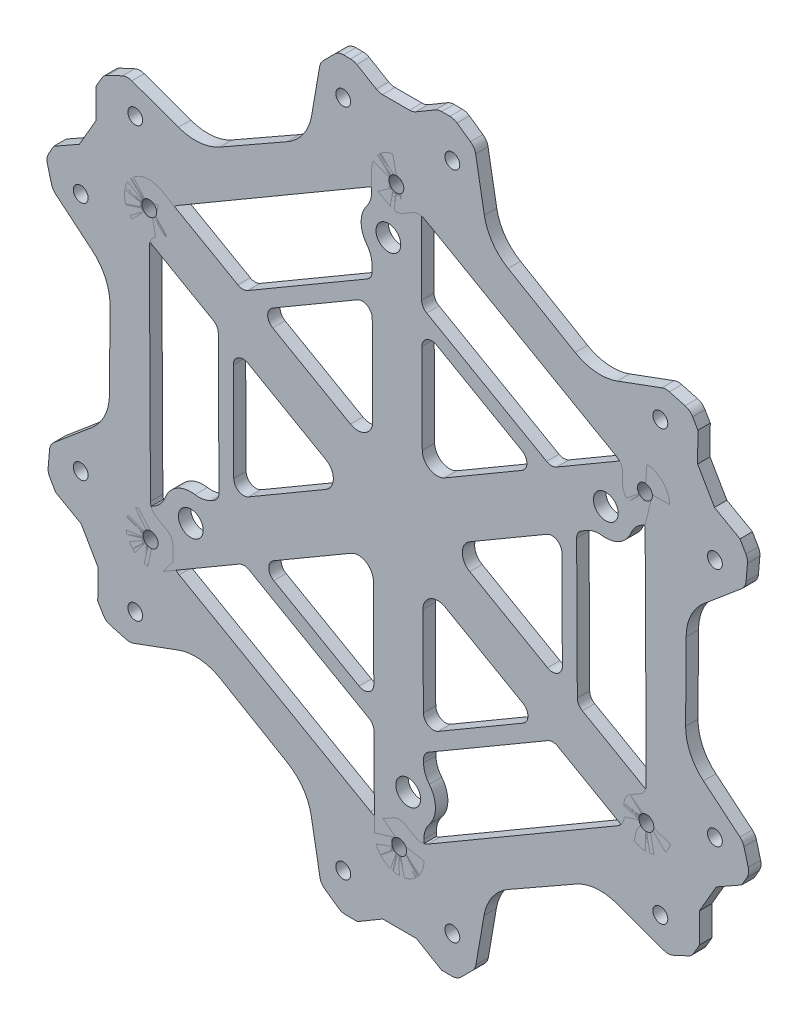
from build123d import *
from OCP.BRepFilletAPI import BRepFilletAPI_MakeChamfer

# Parameters (mm, degrees)
BOSS_EXTRUDE1_DEPTH     = 2.5
FILLET2_R               = 10
CHAMFER1_SIZE           = 3
CHAMFER1_SIZE2          = 3.705314064
CHAMFER1_SIZE2_2        = 3.678458211
CUT_EXTRUDE2_DEPTH      = 2.5
CIRPATTERN1_COUNT       = 6
CUT_EXTRUDE4_DEPTH      = 9.5
SKETCH8_R               = 1.5
CUT_EXTRUDE7_DEPTH      = 9.5
FILLET6_R               = 2.5
CIRPATTERN3_COUNT       = 6
BOSS_EXTRUDE2_OUTLINE_R = 1.5
BOSS_EXTRUDE2_DEPTH     = 2.5
FILLET7_R               = 3
BOSS_EXTRUDE3_DEPTH     = 2.5
FILLET8_R               = 2
SKETCH13_R              = 2.5
CUT_EXTRUDE8_DEPTH      = 10
SKETCH14_R              = 5.5
SKETCH14_R_2            = 2.5
BOSS_EXTRUDE4_DEPTH     = 2.5
FILLET9_R               = 5


# Read off the part's stored shape, not the designer's step: Boss-Extrude2
with BuildPart() as part:
    # Sketch1 → Boss-Extrude1 (new body)
    with BuildSketch(Plane.XY):
        Polygon((15, 75), (-15, 75), (-18.188921512, 56.50369281), (-39.913618866, 44.132859174), (-57.451905284, 50.490381057), (-72.451905284, 24.509618943), (-58.028094137, 12.499778308), (-58.176986619, -12.499778308), (-72.451905284, -24.509618943), (-57.451905284, -50.490381057), (-39.839172625, -44.003914502), (-18.263367753, -56.632637482), (-15, -75), (15, -75), (18.188921512, -56.50369281), (39.913618866, -44.132859174), (57.451905284, -50.490381057), (72.451905284, -24.509618943), (58.028094137, -12.499778308), (58.176986619, 12.499778308), (72.451905284, 24.509618943), (57.451905284, 50.490381057), (39.839172625, 44.003914502), (18.263367753, 56.632637482), align=None)
    extrude(amount=BOSS_EXTRUDE1_DEPTH)

    # Fillet2
    fillet2_edges = [part.edges().sort_by_distance(p)[0] for p in [
        (18.263367753, 56.632637482, 1.25),
        (39.839172625, 44.003914502, 1.25),
        (58.176986619, 12.499778308, 1.25),
        (58.028094137, -12.499778308, 1.25),
        (39.913618866, -44.132859174, 1.25),
        (18.188921512, -56.50369281, 1.25),
        (-18.263367753, -56.632637482, 1.25),
        (-39.839172625, -44.003914502, 1.25),
        (-58.176986619, -12.499778308, 1.25),
        (-58.028094137, 12.499778308, 1.25),
        (-39.913618866, 44.132859174, 1.25),
        (-18.188921512, 56.50369281, 1.25),
    ]]
    fillet(fillet2_edges, radius=FILLET2_R)

    # Chamfer1: one chamfer whose edges measure the first distance from different faces: ONE call of the kernel's chamfer builder (chamfer() names one face for all edges)
    chamfer1_edges_1 = [part.edges().sort_by_distance(p)[0] for p in [
        (15, 75, 1.25),
    ]]
    chamfer1_side_1 = [part.faces().sort_by_distance(p)[0] for p in [
        (16.227681019, 68.090186566, 1.25),
    ]]
    chamfer1_edges_2 = [part.edges().sort_by_distance(p)[0] for p in [
        (57.451905284, 50.490381057, 1.25),
    ]]
    chamfer1_side_2 = [part.faces().sort_by_distance(p)[0] for p in [
        (64.951905284, 37.5, 1.25),
    ]]
    chamfer1_edges_3 = [part.edges().sort_by_distance(p)[0] for p in [
        (72.451905284, 24.509618943, 1.25),
    ]]
    chamfer1_side_3 = [part.faces().sort_by_distance(p)[0] for p in [
        (67.081671824, 19.991509275, 1.25),
    ]]
    chamfer1_edges_4 = [part.edges().sort_by_distance(p)[0] for p in [
        (72.451905284, -24.509618943, 1.25),
    ]]
    chamfer1_side_4 = [part.faces().sort_by_distance(p)[0] for p in [
        (64.951905284, -37.5, 1.25),
    ]]
    chamfer1_edges_5 = [part.edges().sort_by_distance(p)[0] for p in [
        (57.451905284, -50.490381057, 1.25),
    ]]
    chamfer1_side_5 = [part.faces().sort_by_distance(p)[0] for p in [
        (50.853990805, -48.09867729, 1.25),
    ]]
    chamfer1_edges_6 = [part.edges().sort_by_distance(p)[0] for p in [
        (15, -75, 1.25),
    ]]
    chamfer1_side_6 = [part.faces().sort_by_distance(p)[0] for p in [
        (0, -75, 1.25),
    ]]
    chamfer1_edges_7 = [part.edges().sort_by_distance(p)[0] for p in [
        (-15, -75, 1.25),
    ]]
    chamfer1_side_7 = [part.faces().sort_by_distance(p)[0] for p in [
        (-16.227681019, -68.090186566, 1.25),
    ]]
    chamfer1_edges_8 = [part.edges().sort_by_distance(p)[0] for p in [
        (-57.451905284, -50.490381057, 1.25),
    ]]
    chamfer1_side_8 = [part.faces().sort_by_distance(p)[0] for p in [
        (-64.951905284, -37.5, 1.25),
    ]]
    chamfer1_edges_9 = [part.edges().sort_by_distance(p)[0] for p in [
        (-72.451905284, -24.509618943, 1.25),
    ]]
    chamfer1_side_9 = [part.faces().sort_by_distance(p)[0] for p in [
        (-67.081671824, -19.991509275, 1.25),
    ]]
    chamfer1_edges_10 = [part.edges().sort_by_distance(p)[0] for p in [
        (-72.451905284, 24.509618943, 1.25),
    ]]
    chamfer1_side_10 = [part.faces().sort_by_distance(p)[0] for p in [
        (-64.951905284, 37.5, 1.25),
    ]]
    chamfer1_edges_11 = [part.edges().sort_by_distance(p)[0] for p in [
        (-57.451905284, 50.490381057, 1.25),
    ]]
    chamfer1_side_11 = [part.faces().sort_by_distance(p)[0] for p in [
        (-50.853990805, 48.09867729, 1.25),
    ]]
    chamfer1_edges_12 = [part.edges().sort_by_distance(p)[0] for p in [
        (-15, 75, 1.25),
    ]]
    chamfer1_side_12 = [part.faces().sort_by_distance(p)[0] for p in [
        (0, 75, 1.25),
    ]]
    chamfer1 = BRepFilletAPI_MakeChamfer(part.part.solid().wrapped)
    for e in chamfer1_edges_1:
        chamfer1.Add(CHAMFER1_SIZE, CHAMFER1_SIZE2, e.wrapped, chamfer1_side_1[0].wrapped)  # the first distance lies on this face
    for e in chamfer1_edges_2:
        chamfer1.Add(CHAMFER1_SIZE, CHAMFER1_SIZE2_2, e.wrapped, chamfer1_side_2[0].wrapped)  # the first distance lies on this face
    for e in chamfer1_edges_3:
        chamfer1.Add(CHAMFER1_SIZE, CHAMFER1_SIZE2, e.wrapped, chamfer1_side_3[0].wrapped)  # the first distance lies on this face
    for e in chamfer1_edges_4:
        chamfer1.Add(CHAMFER1_SIZE, CHAMFER1_SIZE2_2, e.wrapped, chamfer1_side_4[0].wrapped)  # the first distance lies on this face
    for e in chamfer1_edges_5:
        chamfer1.Add(CHAMFER1_SIZE, CHAMFER1_SIZE2, e.wrapped, chamfer1_side_5[0].wrapped)  # the first distance lies on this face
    for e in chamfer1_edges_6:
        chamfer1.Add(CHAMFER1_SIZE, CHAMFER1_SIZE2_2, e.wrapped, chamfer1_side_6[0].wrapped)  # the first distance lies on this face
    for e in chamfer1_edges_7:
        chamfer1.Add(CHAMFER1_SIZE, CHAMFER1_SIZE2, e.wrapped, chamfer1_side_7[0].wrapped)  # the first distance lies on this face
    for e in chamfer1_edges_8:
        chamfer1.Add(CHAMFER1_SIZE, CHAMFER1_SIZE2_2, e.wrapped, chamfer1_side_8[0].wrapped)  # the first distance lies on this face
    for e in chamfer1_edges_9:
        chamfer1.Add(CHAMFER1_SIZE, CHAMFER1_SIZE2, e.wrapped, chamfer1_side_9[0].wrapped)  # the first distance lies on this face
    for e in chamfer1_edges_10:
        chamfer1.Add(CHAMFER1_SIZE, CHAMFER1_SIZE2_2, e.wrapped, chamfer1_side_10[0].wrapped)  # the first distance lies on this face
    for e in chamfer1_edges_11:
        chamfer1.Add(CHAMFER1_SIZE, CHAMFER1_SIZE2, e.wrapped, chamfer1_side_11[0].wrapped)  # the first distance lies on this face
    for e in chamfer1_edges_12:
        chamfer1.Add(CHAMFER1_SIZE, CHAMFER1_SIZE2_2, e.wrapped, chamfer1_side_12[0].wrapped)  # the first distance lies on this face
    add(Compound.cast(chamfer1.Shape()), mode=Mode.REPLACE)

    # Sketch2 → Cut-Extrude2 (cut)
    with BuildSketch(Plane.XY):
        with BuildLine():
            ThreePointArc((12.5, 67.5), (11, 69), (9.5, 67.5))
            Line((9.5, 67.5), (12.5, 67.5))
        make_face()
        with BuildLine():
            Line((12.5, 67.5), (9.5, 67.5))
            ThreePointArc((9.5, 67.5), (11, 66), (12.5, 67.5))
        make_face()
        with BuildLine():
            ThreePointArc((-9.5, 67.5), (-11, 69), (-12.5, 67.5))
            Line((-12.5, 67.5), (-11, 67.5))
            Line((-11, 67.5), (-9.5, 67.5))
        make_face()
        with BuildLine():
            Line((-11, 67.5), (-12.5, 67.5))
            ThreePointArc((-12.5, 67.5), (-11, 66), (-9.5, 67.5))
            Line((-9.5, 67.5), (-11, 67.5))
        make_face()
    cut_extrude2 = extrude(amount=CUT_EXTRUDE2_DEPTH, mode=Mode.SUBTRACT)

    # CirPattern1: Cut-Extrude2 ×6 about axis
    cirpattern1_axis = Axis((0, 0, 0), (0, 0, 1))
    for i in range(1, CIRPATTERN1_COUNT):
        add(cut_extrude2.rotate(cirpattern1_axis, i * 360 / CIRPATTERN1_COUNT), mode=Mode.SUBTRACT)

    # Sketch5 → Cut-Extrude4 (cut)
    with BuildSketch(Plane(origin=(0, 0, 0), x_dir=(-1, 0, 0), z_dir=(0, 0, -1))):
        Polygon((8.852657032, 75), (-8.147342968, 75), (-3.047342968, 72), (3.752657032, 72), align=None)
    cut_extrude4 = extrude(amount=-CUT_EXTRUDE4_DEPTH, mode=Mode.SUBTRACT)

    # Sketch8 → Cut-Extrude7 (cut)
    with BuildSketch(Plane(origin=(0, 0, 0), x_dir=(-1, 0, 0), z_dir=(0, 0, -1))):
        with Locations((0.282783597, 57.734334384)):
            Circle(SKETCH8_R)
        Polygon((45.653571285, 31.24235526), (4.770004358, 55.114248537), (0.257333073, 52.538244289), (-4.229887687, 55.158330137), (-45.345337164, 31.688069218), (-45.370787688, 26.491979124), (-49.883458972, 23.915974876), (-50.115341522, -23.426179318), (-45.628120762, -26.046265166), (-45.653571285, -31.24235526), (-4.770004358, -55.114248537), (-0.257333073, -52.538244289), (4.229887687, -55.158330137), (45.345337164, -31.688069218), (45.370787688, -26.491979124), (49.883458972, -23.915974876), (50.115341522, 23.426179318), (45.628120762, 26.046265166), align=None)
        with Locations((50.140792046, 28.622269413)):
            Circle(SKETCH8_R)
        with Locations((-49.858008449, 29.112064971)):
            Circle(SKETCH8_R)
        with Locations((49.858008449, -29.112064971)):
            Circle(SKETCH8_R)
        with Locations((-50.140792046, -28.622269413)):
            Circle(SKETCH8_R)
        with Locations((-0.282783597, -57.734334384)):
            Circle(SKETCH8_R)
    extrude(amount=-CUT_EXTRUDE7_DEPTH, mode=Mode.SUBTRACT)

    # Fillet6
    fillet6_edges = [part.edges().sort_by_distance(p)[0] for p in [
        (54.000094564, 49.219138529, 1.25),
        (70.599248252, 27.718515051, 1.25),
        (58.951905284, 47.892304845, 1.25),
        (70.15628898, 22.57826041, 1.25),
        (69.6250716, -22.155884435, 1.25),
        (59.304562316, -47.281484949, 1.25),
        (70.951905284, -27.107695155, 1.25),
        (54.631491578, -49.467998287, 1.25),
        (15.624977036, -71.375022964, 1.25),
        (-11.294685936, -75, 1.25),
        (12, -75, 1.25),
        (-15.524797401, -72.046258697, 1.25),
        (-54.000094564, -49.219138529, 1.25),
        (-70.599248252, -27.718515051, 1.25),
        (-58.951905284, -47.892304845, 1.25),
        (-70.15628898, -22.57826041, 1.25),
        (-69.6250716, 22.155884435, 1.25),
        (-59.304562316, 47.281484949, 1.25),
        (-70.951905284, 27.107695155, 1.25),
        (-54.631491578, 49.467998287, 1.25),
        (-15.624977036, 71.375022964, 1.25),
        (11.294685936, 75, 1.25),
        (-12, 75, 1.25),
        (15.524797401, 72.046258697, 1.25),
        (3.047342968, 72, 1.25),
        (8.147342968, 75, 1.25),
        (-8.852657032, 75, 1.25),
        (-3.752657032, 72, 1.25),
        (49.883458972, 23.915974876, 1.25),
        (45.370787688, 26.491979124, 1.25),
        (45.345337164, 31.688069218, 1.25),
        (4.229887687, 55.158330137, 1.25),
        (-0.257333073, 52.538244289, 1.25),
        (-4.770004358, 55.114248537, 1.25),
        (-45.653571285, 31.24235526, 1.25),
        (-45.628120762, 26.046265166, 1.25),
        (-50.115341522, 23.426179318, 1.25),
        (-49.883458972, -23.915974876, 1.25),
        (-45.370787688, -26.491979124, 1.25),
        (-45.345337164, -31.688069218, 1.25),
        (-4.229887687, -55.158330137, 1.25),
        (0.257333073, -52.538244289, 1.25),
        (4.770004358, -55.114248537, 1.25),
        (45.653571285, -31.24235526, 1.25),
        (45.628120762, -26.046265166, 1.25),
        (50.115341522, -23.426179318, 1.25),
    ]]
    fillet(fillet6_edges, radius=FILLET6_R)

    # CirPattern3: Cut-Extrude4 ×6 about axis
    cirpattern3_axis = Axis((0, 0, 0), (0, 0, 1))
    for i in range(1, CIRPATTERN3_COUNT):
        add(cut_extrude4.rotate(cirpattern3_axis, i * 360 / CIRPATTERN3_COUNT), mode=Mode.SUBTRACT)


with BuildPart() as body_2:
    # Boss-Extrude2 outline → Boss-Extrude2 (new body)
    with BuildSketch(Plane.XY):
        with BuildLine():
            ThreePointArc((47.662030803, -32.964589381), (54.483112014, -31.101030656), (52.619553288, -24.279949445))
            Line((52.619553288, -24.279949445), (9.999880049, 0.048979556))
            Line((9.999880049, 0.048979556), (52.379187231, 24.794234781))
            ThreePointArc((52.379187231, 24.794234781), (54.175838638, 31.633243753), (47.336829666, 33.429895161))
            Line((47.336829666, 33.429895161), (4.957522485, 8.684639936))
            Line((4.957522485, 8.684639936), (4.717156427, 57.758824162))
            ThreePointArc((4.717156427, 57.758824162), (-0.307273376, 62.734274409), (-5.282723622, 57.709844606))
            Line((-5.282723622, 57.709844606), (-5.042357564, 8.63566038))
            Line((-5.042357564, 8.63566038), (-47.662030803, 32.964589381))
            ThreePointArc((-47.662030803, 32.964589381), (-54.483112014, 31.101030656), (-52.619553288, 24.279949445))
            Line((-52.619553288, 24.279949445), (-9.999880049, -0.048979556))
            Line((-9.999880049, -0.048979556), (-52.379187231, -24.794234781))
            ThreePointArc((-52.379187231, -24.794234781), (-54.175838638, -31.633243753), (-47.336829666, -33.429895161))
            Line((-47.336829666, -33.429895161), (-4.957522485, -8.684639936))
            Line((-4.957522485, -8.684639936), (-4.717156427, -57.758824162))
            ThreePointArc((-4.717156427, -57.758824162), (0.307273376, -62.734274409), (5.282723622, -57.709844606))
            Line((5.282723622, -57.709844606), (5.042357564, -8.63566038))
            Line((5.042357564, -8.63566038), (47.662030803, -32.964589381))
        make_face()
        with Locations((-49.858008449, -29.112064971)):
            Circle(BOSS_EXTRUDE2_OUTLINE_R, mode=Mode.SUBTRACT)
        with Locations((0.282783597, -57.734334384)):
            Circle(BOSS_EXTRUDE2_OUTLINE_R, mode=Mode.SUBTRACT)
        with Locations((50.140792046, -28.622269413)):
            Circle(BOSS_EXTRUDE2_OUTLINE_R, mode=Mode.SUBTRACT)
        with Locations((-50.140792046, 28.622269413)):
            Circle(BOSS_EXTRUDE2_OUTLINE_R, mode=Mode.SUBTRACT)
        with Locations((-0.282783597, 57.734334384)):
            Circle(BOSS_EXTRUDE2_OUTLINE_R, mode=Mode.SUBTRACT)
        with Locations((49.858008449, 29.112064971)):
            Circle(BOSS_EXTRUDE2_OUTLINE_R, mode=Mode.SUBTRACT)
    extrude(amount=BOSS_EXTRUDE2_DEPTH)

    # Fillet7
    fillet7_edges = [body_2.edges().sort_by_distance(p)[0] for p in [
        (5.042357564, -8.63566038, 1.25),
        (-4.957522485, -8.684639936, 1.25),
        (-9.999880049, -0.048979556, 1.25),
        (-5.042357564, 8.63566038, 1.25),
        (4.957522485, 8.684639936, 1.25),
        (9.999880049, 0.048979556, 1.25),
    ]]
    fillet(fillet7_edges, radius=FILLET7_R)

    # Sketch11 → Boss-Extrude3 (add)
    with BuildSketch(Plane(origin=(0, 0, 0), x_dir=(-1, 0, 0), z_dir=(0, 0, -1))):
        Polygon((5.190202576, 38.820343732), (5.181719068, 37.088313701), (29.752758897, 22.741296438), (31.256982659, 23.59996452), align=None)
        Polygon((29.752758897, 22.741296438), (5.181719068, 37.088313701), (5.17323556, 35.356283669), (28.248535136, 21.882628355), align=None)
        Polygon((36.214505144, 14.915324585), (34.710281382, 14.056656502), (34.570919879, -14.395996819), (36.066660132, -15.269358768), align=None)
        Polygon((34.570919879, -14.395996819), (34.710281382, 14.056656502), (33.206057621, 13.19798842), (33.075179625, -13.52263487), align=None)
        Polygon((31.024302568, -23.905019148), (29.528562314, -23.031657199), (4.818160981, -37.137293256), (4.809677473, -38.869323288), align=None)
        Polygon((4.818160981, -37.137293256), (29.528562314, -23.031657199), (28.032822061, -22.158295249), (4.826644489, -35.405263225), align=None)
        Polygon((-28.248535136, -21.882628355), (-29.752758897, -22.741296438), (-5.181719068, -37.088313701), (-5.17323556, -35.356283669), align=None)
        Polygon((-5.181719068, -37.088313701), (-29.752758897, -22.741296438), (-31.256982659, -23.59996452), (-5.190202576, -38.820343732), align=None)
        Polygon((-33.075179625, 13.52263487), (-34.570919879, 14.395996819), (-34.710281382, -14.056656502), (-33.206057621, -13.19798842), align=None)
        Polygon((-34.710281382, -14.056656502), (-34.570919879, 14.395996819), (-36.066660132, 15.269358768), (-36.214505144, -14.915324585), align=None)
        Polygon((-29.528562314, 23.031657199), (-4.818160981, 37.137293256), (-4.809677473, 38.869323288), (-31.024302568, 23.905019148), align=None)
        Polygon((-4.826644489, 35.405263225), (-4.818160981, 37.137293256), (-29.528562314, 23.031657199), (-28.032822061, 22.158295249), align=None)
    extrude(amount=-BOSS_EXTRUDE3_DEPTH)

    # Fillet8
    fillet8_edges = [body_2.edges().sort_by_distance(p)[0] for p in [
        (-31.256982659, 23.59996452, 1.25),
        (-28.248535136, 21.882628355, 1.25),
        (-5.17323556, 35.356283669, 1.25),
        (-5.190202576, 38.820343732, 1.25),
        (-36.066660132, -15.269358768, 1.25),
        (-33.075179625, -13.52263487, 1.25),
        (-33.206057621, 13.19798842, 1.25),
        (-36.214505144, 14.915324585, 1.25),
        (-4.809677473, -38.869323288, 1.25),
        (-4.826644489, -35.405263225, 1.25),
        (-28.032822061, -22.158295249, 1.25),
        (-31.024302568, -23.905019148, 1.25),
        (28.248535136, -21.882628355, 1.25),
        (5.17323556, -35.356283669, 1.25),
        (5.190202576, -38.820343732, 1.25),
        (31.256982659, -23.59996452, 1.25),
        (33.075179625, 13.52263487, 1.25),
        (33.206057621, -13.19798842, 1.25),
        (36.214505144, -14.915324585, 1.25),
        (36.066660132, 15.269358768, 1.25),
        (4.809677473, 38.869323288, 1.25),
        (4.826644489, 35.405263225, 1.25),
        (28.032822061, 22.158295249, 1.25),
        (31.024302568, 23.905019148, 1.25),
    ]]
    fillet(fillet8_edges, radius=FILLET8_R)

    # Sketch13 → Cut-Extrude8 (cut)
    with BuildSketch(Plane.XY.offset(2.5)):
        with Locations((2.098625897, -47.256304017)):
            Circle(SKETCH13_R)
        with Locations((-41.758805778, -22.220815467)):
            Circle(SKETCH13_R)
        with Locations((41.957106677, 22.568201064)):
            Circle(SKETCH13_R)
        with Locations((-1.900324997, 47.603689614)):
            Circle(SKETCH13_R)
    extrude(amount=-CUT_EXTRUDE8_DEPTH, mode=Mode.SUBTRACT)

    # Sketch14 → Boss-Extrude4 (add)
    # profile 1 of 4: a face of its own
    with BuildSketch(Plane.XY.offset(2.5)):
        with Locations((41.957106677, 22.568201064)):
            Circle(SKETCH14_R)
        with Locations((41.957106677, 22.568201064)):
            Circle(SKETCH14_R_2, mode=Mode.SUBTRACT)
    # profile 2 of 4: a face of its own
    with BuildSketch(Plane.XY.offset(2.5)):
        with Locations((-1.900324997, 47.603689614)):
            Circle(SKETCH14_R)
        with Locations((-1.900324997, 47.603689614)):
            Circle(SKETCH14_R_2, mode=Mode.SUBTRACT)
    # profile 3 of 4: a face of its own
    with BuildSketch(Plane.XY.offset(2.5)):
        with Locations((-41.758805778, -22.220815467)):
            Circle(SKETCH14_R)
        with Locations((-41.758805778, -22.220815467)):
            Circle(SKETCH14_R_2, mode=Mode.SUBTRACT)
    # profile 4 of 4: a face of its own
    with BuildSketch(Plane.XY.offset(2.5)):
        with Locations((2.098625897, -47.256304017)):
            Circle(SKETCH14_R)
        with Locations((2.098625897, -47.256304017)):
            Circle(SKETCH14_R_2, mode=Mode.SUBTRACT)
    extrude(amount=-BOSS_EXTRUDE4_DEPTH)

    # Fillet9
    fillet9_edges = [body_2.edges().sort_by_distance(p)[0] for p in [
        (39.859410699, 17.483943834, 1.25),
        (47.415895563, 21.896171381, 1.25),
        (-5.254572929, 51.962476236, 1.25),
        (-5.211714218, 43.212254607, 1.25),
        (-47.242281816, -21.794798405, 1.25),
        (-39.434728345, -17.23597203, 1.25),
        (5.209305514, -42.720482998, 1.25),
        (5.253588231, -51.761435832, 1.25),
    ]]
    fillet(fillet9_edges, radius=FILLET9_R)


solid = Compound([part.part, body_2.part])
